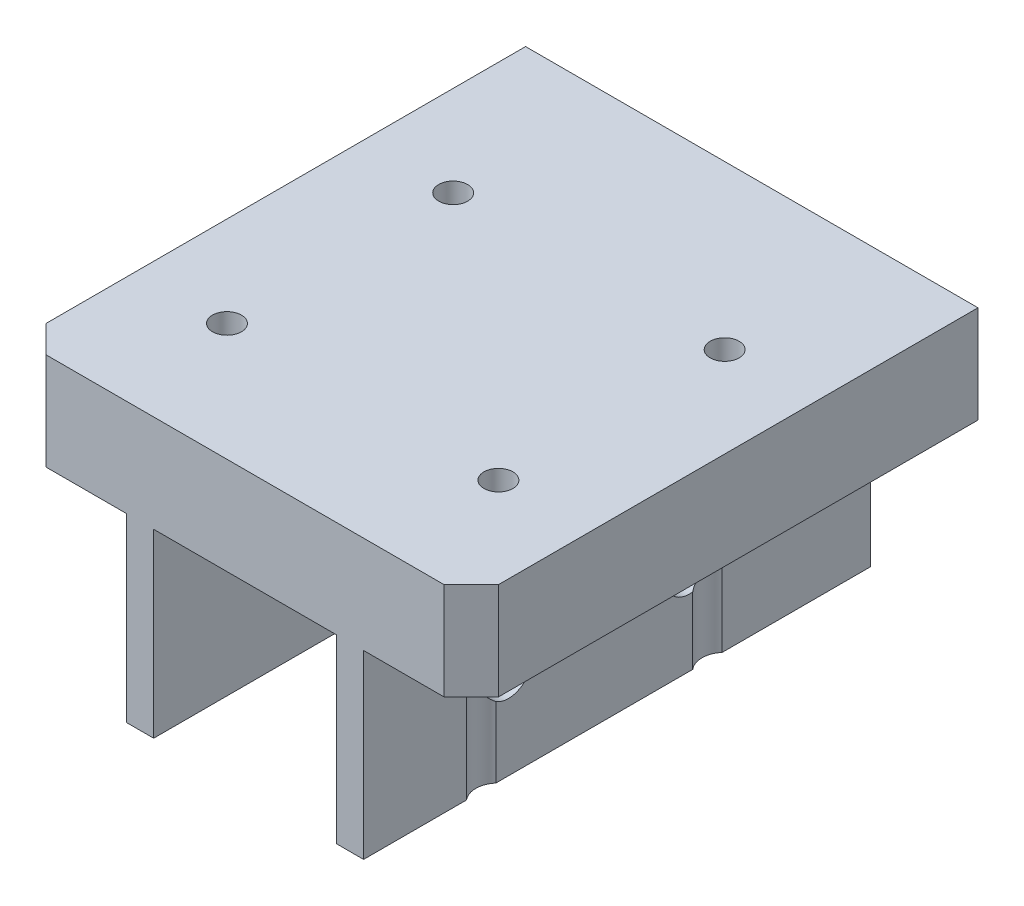
from build123d import *

# Parameters (mm, degrees)
EXTRUDE_1_DEPTH             = 53
HOLE_WIZARD_1_D             = 3
SKETCH_6_R                  = 2.5
CUT_EXTRUDE_1_DEPTH         = 62.919302322
CHAMFER_1_SIZE              = 3
HOLE_WIZARD_2_D             = 5.2
HOLE_WIZARD_M3_1_AT_2_COUNT = 2
HOLE_WIZARD_M3_1_AT_2_PITCH = 30
HOLE_WIZARD_M3_1_AT_3_COUNT = 2
HOLE_WIZARD_M3_1_AT_3_PITCH = 39.05124838
HOLE_WIZARD_M3_1_AT_4_COUNT = 2
HOLE_WIZARD_M3_1_AT_4_PITCH = 25
EXTRUDE_2_DEPTH             = 3


with BuildPart() as part:
    # 草图1 → 凸台-拉伸1 (new body)
    with BuildSketch(Plane.XY):
        Polygon((-13.1, -14.961364275), (-10.1, -14.961364275), (-10.1, 5.038635725), (10.1, 5.038635725), (10.1, -14.961364275), (13.1, -14.961364275), (13.1, 5.038635725), (25, 5.038635725), (25, 15.788635725), (-25, 15.788635725), (-25, 5.038635725), (-13.1, 5.038635725), align=None)
    extrude(amount=EXTRUDE_1_DEPTH)

    # 孔1 (through all)
    with Locations(Plane(origin=(0, 5.038635725, 0), x_dir=(-1, 0, 0), z_dir=(0, -1, 0))):
        with Locations((15, -15), (15, -40), (-15, -15), (-15, -40)):
            Hole(HOLE_WIZARD_1_D / 2)

    # 草图6 → 切除-拉伸1 (cut, through all)
    with BuildSketch(Plane.XZ.offset(-5.038635725)):
        with Locations((15, 40)):
            Circle(SKETCH_6_R)
        with Locations((15, 15)):
            Circle(SKETCH_6_R)
        with Locations((-15, 15)):
            Circle(SKETCH_6_R)
        with Locations((-15, 40)):
            Circle(SKETCH_6_R)
    extrude(amount=CUT_EXTRUDE_1_DEPTH, mode=Mode.SUBTRACT)

    # 倒角1
    chamfer_1_edges = [part.edges().sort_by_distance(p)[0] for p in [
        (25, 10.413635725, 53),
        (-25, 10.413635725, 53),
    ]]
    chamfer(chamfer_1_edges, length=CHAMFER_1_SIZE)

    # 孔2 (through all)
    with Locations(Plane(origin=(13.1, 0, 0), x_dir=(0, 0, -1), z_dir=(1, 0, 0))):
        with Locations((-17, -4.961364275), (-37, -4.961364275)):
            Hole(HOLE_WIZARD_2_D / 2)

    # 草图10 → M3 十字槽沉头木螺钉的锥形沉头孔1 (revolve, cut)
    with BuildSketch(Plane(origin=(15, 5.038635725, 15), x_dir=(0, 0, -1), z_dir=(1, 0, 0))):
        Polygon((0, 0), (0, 10.75), (1.6, 10.75), (1.6, 1.7), (3.3, 0), align=None)
    hole_wizard_m3_1 = revolve(axis=Axis((15, -1.311364275, 15), (0, 1, 0)), mode=Mode.SUBTRACT)

    # M3 十字槽沉头木螺钉的锥形沉头孔1 at 2: M3 十字槽沉头木螺钉的锥形沉头孔1 ×2
    with Locations(*[(-i * HOLE_WIZARD_M3_1_AT_2_PITCH, 0, 0) for i in range(1, HOLE_WIZARD_M3_1_AT_2_COUNT)]):
        add(hole_wizard_m3_1, mode=Mode.SUBTRACT)

    # M3 十字槽沉头木螺钉的锥形沉头孔1 at 3: M3 十字槽沉头木螺钉的锥形沉头孔1 ×2
    with Locations(*[Vector(-0.7682212795973759, 0, 0.64018439966448) * (i * HOLE_WIZARD_M3_1_AT_3_PITCH) for i in range(1, HOLE_WIZARD_M3_1_AT_3_COUNT)]):
        add(hole_wizard_m3_1, mode=Mode.SUBTRACT)

    # M3 十字槽沉头木螺钉的锥形沉头孔1 at 4: M3 十字槽沉头木螺钉的锥形沉头孔1 ×2
    with Locations(*[(0, 0, i * HOLE_WIZARD_M3_1_AT_4_PITCH) for i in range(1, HOLE_WIZARD_M3_1_AT_4_COUNT)]):
        add(hole_wizard_m3_1, mode=Mode.SUBTRACT)

    # 切除-拉伸2 cone 1 section (through the dimple's axis) → 切除-拉伸2 (revolve, cut)
    with BuildSketch(Plane(origin=(15, 5.038635725, 40), x_dir=(0, 0, 1), z_dir=(1, 0, 0))):
        Polygon((0, 0), (3.3, 0), (0, 20.835379998), align=None)
    revolve(axis=Axis((15, 5.038635725, 40), (0, -1, 0)), mode=Mode.SUBTRACT)

    # 切除-拉伸2 cone 2 section (through the dimple's axis) → 切除-拉伸2 cone 2 (revolve, cut)
    with BuildSketch(Plane(origin=(15, 5.038635725, 15), x_dir=(0, 0, 1), z_dir=(1, 0, 0))):
        Polygon((0, 0), (3.3, 0), (0, 20.835379998), align=None)
    revolve(axis=Axis((15, 5.038635725, 15), (0, -1, 0)), mode=Mode.SUBTRACT)

    # 切除-拉伸2 cone 3 section (through the dimple's axis) → 切除-拉伸2 cone 3 (revolve, cut)
    with BuildSketch(Plane(origin=(-15, 5.038635725, 15), x_dir=(0, 0, 1), z_dir=(1, 0, 0))):
        Polygon((0, 0), (3.3, 0), (0, 20.835379998), align=None)
    revolve(axis=Axis((-15, 5.038635725, 15), (0, -1, 0)), mode=Mode.SUBTRACT)

    # 切除-拉伸2 cone 4 section (through the dimple's axis) → 切除-拉伸2 cone 4 (revolve, cut)
    with BuildSketch(Plane(origin=(-15, 5.038635725, 40), x_dir=(0, 0, 1), z_dir=(1, 0, 0))):
        Polygon((0, 0), (3.3, 0), (0, 20.835379998), align=None)
    revolve(axis=Axis((-15, 5.038635725, 40), (0, -1, 0)), mode=Mode.SUBTRACT)

    # 草图12 → 凸台-拉伸2 (add)
    with BuildSketch(Plane(origin=(0, 0, 0), x_dir=(-1, 0, 0), z_dir=(0, 0, -1))):
        Polygon((-10.1, 5.038635725), (10.1, 5.038635725), (10.1, -14.961364275), (13.1, -14.961364275), (13.1, 5.038635725), (25, 5.038635725), (25, 15.788635725), (-25, 15.788635725), (-25, 5.038635725), (-13.1, 5.038635725), (-13.1, -14.961364275), (-10.1, -14.961364275), align=None)
    extrude(amount=EXTRUDE_2_DEPTH)


solid = part.part
